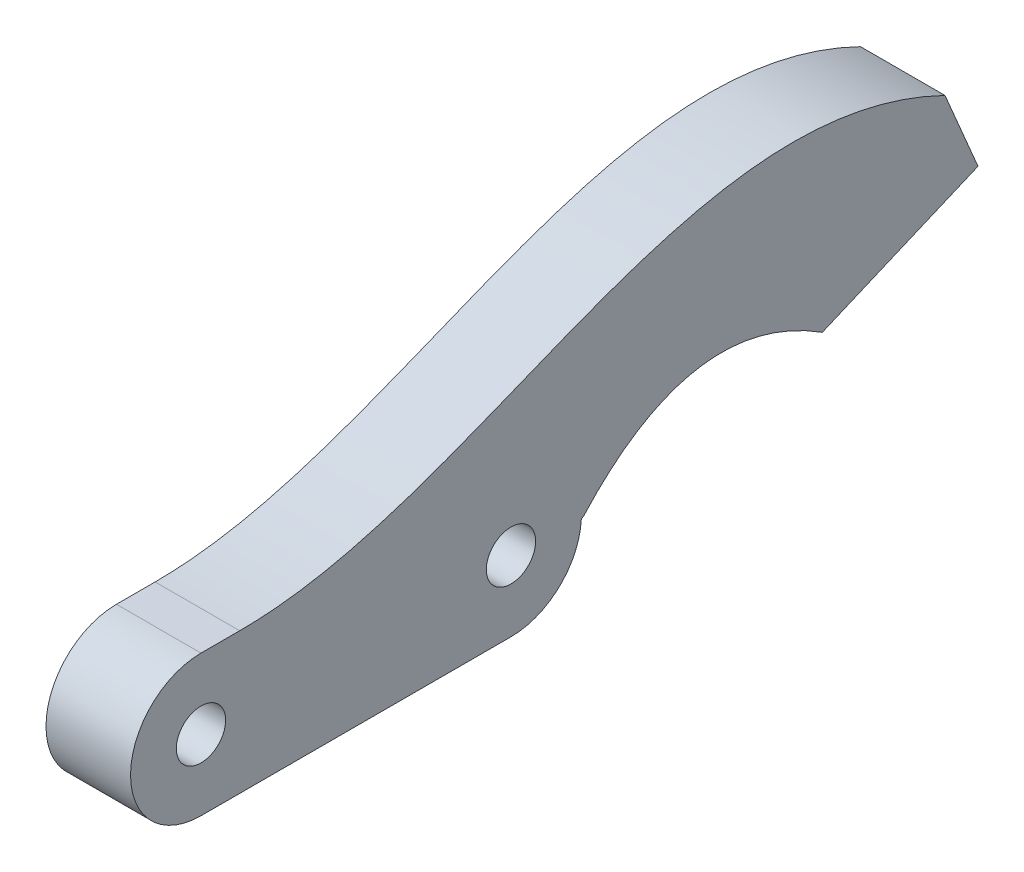
from build123d import *

# Parameters (mm, degrees)
SKETCH1_R           = 1.75
BOSS_EXTRUDE1_DEPTH = 6
BOSS_EXTRUDE2_START = -6
BOSS_EXTRUDE2_DEPTH = 6


with BuildPart() as part:
    # Sketch1 → Boss-Extrude1 (new body)
    with BuildSketch(Plane(origin=(0, 0, 0), x_dir=(0, 0, -1), z_dir=(1, 0, 0))):
        with BuildLine():
            Line((27, 10), (5, 10))
            ThreePointArc((5, 10), (0, 5), (5, 0))
            Line((5, 0), (27, 0))
            ThreePointArc((27, 0), (32, 5), (27, 10))
        make_face()
        with Locations((5, 5)):
            Circle(SKETCH1_R, mode=Mode.SUBTRACT)
        with Locations((27, 5)):
            Circle(SKETCH1_R, mode=Mode.SUBTRACT)
    extrude(amount=BOSS_EXTRUDE1_DEPTH)

    # Sketch2 → Boss-Extrude2 (add)
    with BuildSketch(Plane(origin=(6, 0, 5.948752288), x_dir=(0, 0, -1), z_dir=(1, 0, 0)).offset(BOSS_EXTRUDE2_START)):
        with BuildLine():
            add(Edge.make_bspline(
                [(63.752972286, 17.872423117), (45.928882678, 26.563787963), (31.059268621, 10), (13.694974759, 10)],
                knots=[0, 0, 0, 0, 1, 1, 1, 1], degree=3))
            Line((13.694974759, 10), (27, 10))
            Line((27, 10), (32.948752288, 10))
            ThreePointArc((32.948752288, 10), (36.569937448, 8.447755507), (37.942736719, 4.754807215))
            Line((37.942736719, 4.754807215), (38.08542066, 4.824084077))
            add(Edge.make_bspline(
                [(38.08542066, 4.824084077), (45.879227883, 13.481709162), (55.04551447, 7.665553941)],
                knots=[0, 0, 0, 1, 1, 1], degree=2))
            Line((55.04551447, 7.665553941), (66.094228393, 12.348066156))
            Line((66.094228393, 12.348066156), (63.752972286, 17.872423117))
        make_face()
    extrude(amount=BOSS_EXTRUDE2_DEPTH)


solid = part.part
